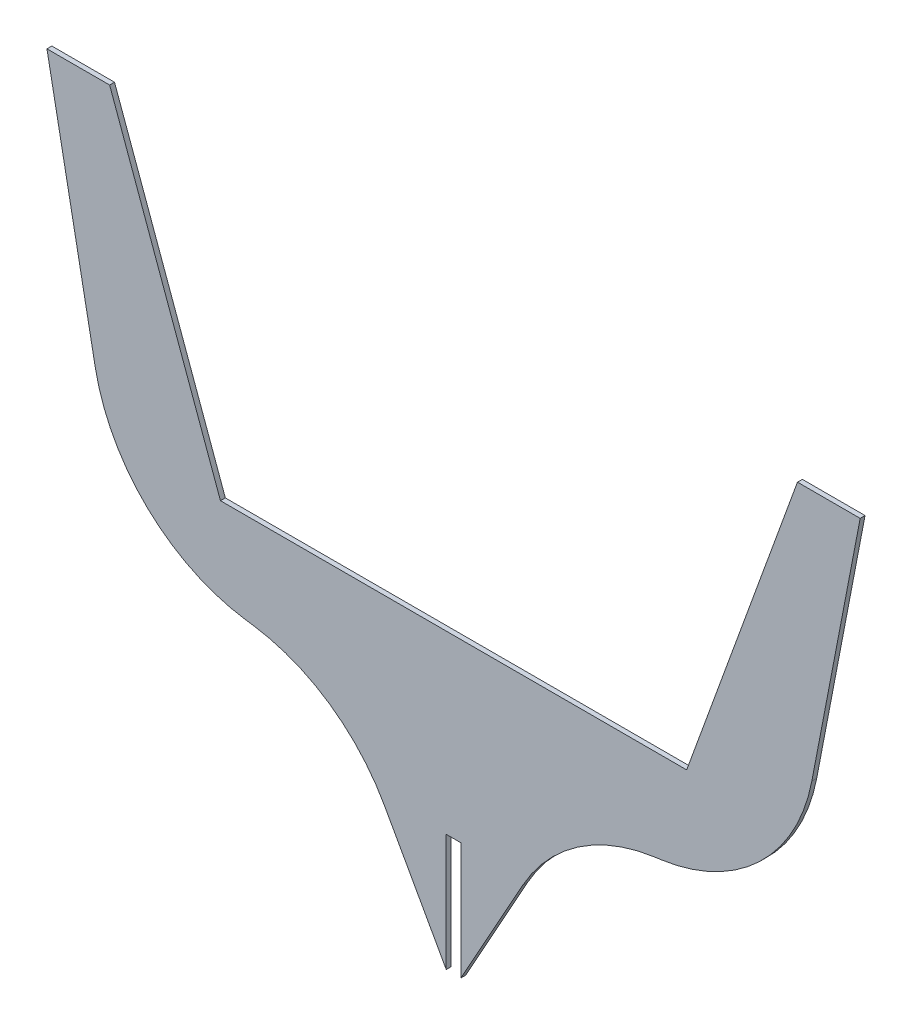
from build123d import *

# Parameters (mm, degrees)
BOSS_EXTRU_3_DEPTH = 3
CONG_1_R           = 110


with BuildPart() as part:
    # Esquisse3 → Boss.-Extru.3 (new body)
    with BuildSketch(Plane.XY):
        Polygon((-5.993169939, 123.576855043), (62.129760791, -63.698009557), (348.787095474, -63.698009557), (416.910026204, 123.576855043), (455.458428133, 123.576855043), (410.916856265, -108.348276409), (274.58078198, -127.690915139), (209.958428133, -243.923144957), (209.958428133, -171.923144957), (200.958428133, -171.923144957), (200.958428133, -243.923144957), (136.336074285, -127.690915139), (0, -108.348276409), (-44.541571867, 123.576855043), align=None)
    extrude(amount=BOSS_EXTRU_3_DEPTH)

    # Congé1
    cong_1_edges = [part.edges().sort_by_distance(p)[0] for p in [
        (410.916856265, -108.348276409, 1.5),
        (274.58078198, -127.690915139, 1.5),
        (136.336074285, -127.690915139, 1.5),
        (0, -108.348276409, 1.5),
    ]]
    fillet(cong_1_edges, radius=CONG_1_R)


solid = part.part
